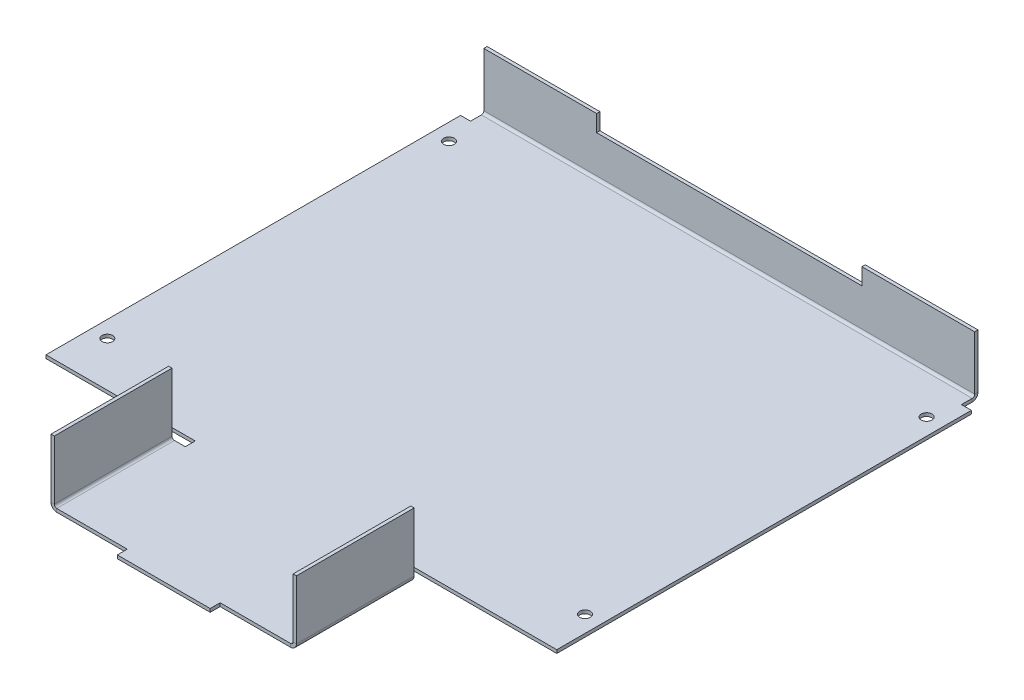
from build123d import *

# Parameters (mm, degrees)
SM_BASE_FLANGE_1_DEPTH           = 1
OTHER_START                      = 68
OTHER_4_DEPTH                    = 35.5
OTHER_4_2_DEPTH                  = 35.5
CUT_EXTRUDE_1_REACH              = 134.863
SKETCH_10_R                      = 1.6
SM_EDGE_FLANGE_1_STRIP_W         = 5.4732
SM_EDGE_FLANGE_1_STRIP_H         = 1
SM_EDGE_FLANGE_1_STRIP_CUT_DEPTH = 154
SM_EDGE_FLANGE_1_DEPTH           = 154
SKETCH_14_W                      = 9.264116278
SKETCH_14_H                      = 12.510211191
CUT_EXTRUDE_2_DEPTH              = 133.863464967
CUT_EXTRUDE_3_REACH              = 190.904
SKETCH_15_W                      = 80
SKETCH_15_H                      = 29.662460086


# Read off the part's stored shape, not the designer's step: 绘制的折弯4
# Sheet-metal steps are written as plain solids
with BuildPart() as part:
    # Sketch 1 → 基体-法兰1 (new body)
    with BuildSketch(Plane(origin=(0, 0, 0), x_dir=(1, 0, 0), z_dir=(0, 1, 0))):
        Polygon((0.031889959, 65), (-77, 65), (-77, -65), (-32, -65), (-32, -68), (-55, -68), (-55, -103.5), (-14, -103.5), (-14, -106.5), (14, -106.5), (14, -103.5), (55, -103.5), (55, -68), (32, -68), (32, -65), (77, -65), (77, 65), align=None)
    extrude(amount=-SM_BASE_FLANGE_1_DEPTH)

    # Other 4 outline → Other 4 (cut)
    with BuildSketch(Plane.XY.offset(OTHER_START)):
        with BuildLine():
            Line((-55, -1), (-35.2634, -1))
            ThreePointArc((-35.2634, -1), (-36.195226164, -0.728828115), (-36.83604109, 0))
            Line((-36.83604109, 0), (-55, 0))
            Line((-55, 0), (-55, -1))
        make_face()
        with BuildLine():
            ThreePointArc((36.83604109, 0), (36.195226164, -0.728828115), (35.2634, -1))
            Line((35.2634, -1), (55, -1))
            Line((55, -1), (55, 0))
            Line((55, 0), (36.83604109, 0))
        make_face()
    extrude(amount=OTHER_4_DEPTH, mode=Mode.SUBTRACT)

    # Other 4 2 outline → Other 4 2 (add)
    with BuildSketch(Plane.XY.offset(OTHER_START)):
        with BuildLine():
            ThreePointArc((-37, 0.7366), (-36.958514757, 0.359286442), (-36.83604109, 0))
            Line((-36.83604109, 0), (-35.2634, 0))
            ThreePointArc((-35.2634, 0), (-35.784254855, 0.215745145), (-36, 0.7366))
            Line((-36, 0.7366), (-36, 18.530753262))
            Line((-36, 18.530753262), (-37, 18.530753262))
            Line((-37, 18.530753262), (-37, 0.7366))
        make_face()
        with BuildLine():
            Line((35.2634, 0), (36.83604109, 0))
            ThreePointArc((36.83604109, 0), (36.958514757, 0.359286442), (37, 0.7366))
            Line((37, 0.7366), (37, 18.530753262))
            Line((37, 18.530753262), (36, 18.530753262))
            Line((36, 18.530753262), (36, 0.7366))
            ThreePointArc((36, 0.7366), (35.784254855, 0.215745145), (35.2634, 0))
        make_face()
    extrude(amount=OTHER_4_2_DEPTH)

    # 草图10 → 切除-拉伸1 (cut, up to next)
    with BuildSketch(Plane.XZ.offset(1), mode=Mode.PRIVATE) as cut_extrude_1_sk1:
        with Locations(Location((-72, -51.5, 0), (0, 0, 270))):
            Circle(SKETCH_10_R)
    cut_extrude_1_tool1 = extrude(cut_extrude_1_sk1.sketch, amount=-CUT_EXTRUDE_1_REACH, mode=Mode.PRIVATE) & part.part
    # 草图10 → 切除-拉伸1 (cut, up to next)
    with BuildSketch(Plane.XZ.offset(1), mode=Mode.PRIVATE) as cut_extrude_1_sk2:
        with Locations(Location((-72, 51.5, 0), (0, 0, 270))):
            Circle(SKETCH_10_R)
    cut_extrude_1_tool2 = extrude(cut_extrude_1_sk2.sketch, amount=-CUT_EXTRUDE_1_REACH, mode=Mode.PRIVATE) & part.part
    # 草图10 → 切除-拉伸1 (cut, up to next)
    with BuildSketch(Plane.XZ.offset(1), mode=Mode.PRIVATE) as cut_extrude_1_sk3:
        with Locations(Location((72, -51.5, 0), (0, 0, 270))):
            Circle(SKETCH_10_R)
    cut_extrude_1_tool3 = extrude(cut_extrude_1_sk3.sketch, amount=-CUT_EXTRUDE_1_REACH, mode=Mode.PRIVATE) & part.part
    # 草图10 → 切除-拉伸1 (cut, up to next)
    with BuildSketch(Plane.XZ.offset(1), mode=Mode.PRIVATE) as cut_extrude_1_sk4:
        with Locations(Location((72, 51.5, 0), (0, 0, 270))):
            Circle(SKETCH_10_R)
    cut_extrude_1_tool4 = extrude(cut_extrude_1_sk4.sketch, amount=-CUT_EXTRUDE_1_REACH, mode=Mode.PRIVATE) & part.part
    add(cut_extrude_1_tool1.solids().sort_by_distance((-72, -1, -51.5))[0], mode=Mode.SUBTRACT)
    add(cut_extrude_1_tool2.solids().sort_by_distance((-72, -1, 51.5))[0], mode=Mode.SUBTRACT)
    add(cut_extrude_1_tool3.solids().sort_by_distance((72, -1, -51.5))[0], mode=Mode.SUBTRACT)
    add(cut_extrude_1_tool4.solids().sort_by_distance((72, -1, 51.5))[0], mode=Mode.SUBTRACT)

    # 边线-法兰1 strip (across the edge) → 边线-法兰1 strip cut (cut)
    with BuildSketch(Plane(origin=(77, 0, -65), x_dir=(0, 0, 1), z_dir=(-1, 0, 0))):
        with Locations((-1, -0.5)):
            Rectangle(SM_EDGE_FLANGE_1_STRIP_W, SM_EDGE_FLANGE_1_STRIP_H)
    extrude(amount=SM_EDGE_FLANGE_1_STRIP_CUT_DEPTH, mode=Mode.SUBTRACT)

    # 边线-法兰1 section (across the edge) → 边线-法兰1 (add)
    with BuildSketch(Plane(origin=(77, 0, -65), x_dir=(0, 0, 1), z_dir=(-1, 0, 0))):
        with BuildLine():
            Line((0, 0.7366), (0, 17))
            Line((0, 17), (1, 17))
            Line((1, 17), (1, 0.7366))
            ThreePointArc((1, 0.7366), (1.215745145, 0.215745145), (1.7366, 0))
            Line((1.7366, 0), (1.7366, -1))
            ThreePointArc((1.7366, -1), (0.508638364, -0.491361636), (0, 0.7366))
        make_face()
    extrude(amount=SM_EDGE_FLANGE_1_DEPTH)

    # 草图14 → 切除-拉伸2 (cut, through all)
    with BuildSketch(Plane.XZ.offset(1)):
        with Locations((-78.632058139, -66.255105596)):
            Rectangle(SKETCH_14_W, SKETCH_14_H)
        with Locations((78.632058139, -66.255105596)):
            Rectangle(SKETCH_14_W, SKETCH_14_H)
    extrude(amount=-CUT_EXTRUDE_2_DEPTH, mode=Mode.SUBTRACT)

    # 草图15 → 切除-拉伸3 (cut, up to next)
    with BuildSketch(Plane(origin=(0, 0, -65), x_dir=(-1, 0, 0), z_dir=(0, 0, -1)), mode=Mode.PRIVATE) as cut_extrude_3_sk1:
        with Locations((0, 26.831230043)):
            Rectangle(SKETCH_15_W, SKETCH_15_H)
    cut_extrude_3_tool1 = extrude(cut_extrude_3_sk1.sketch, amount=-CUT_EXTRUDE_3_REACH, mode=Mode.PRIVATE) & part.part
    add(cut_extrude_3_tool1.solids().sort_by_distance((0, 26.83123, -65))[0], mode=Mode.SUBTRACT)


solid = part.part
